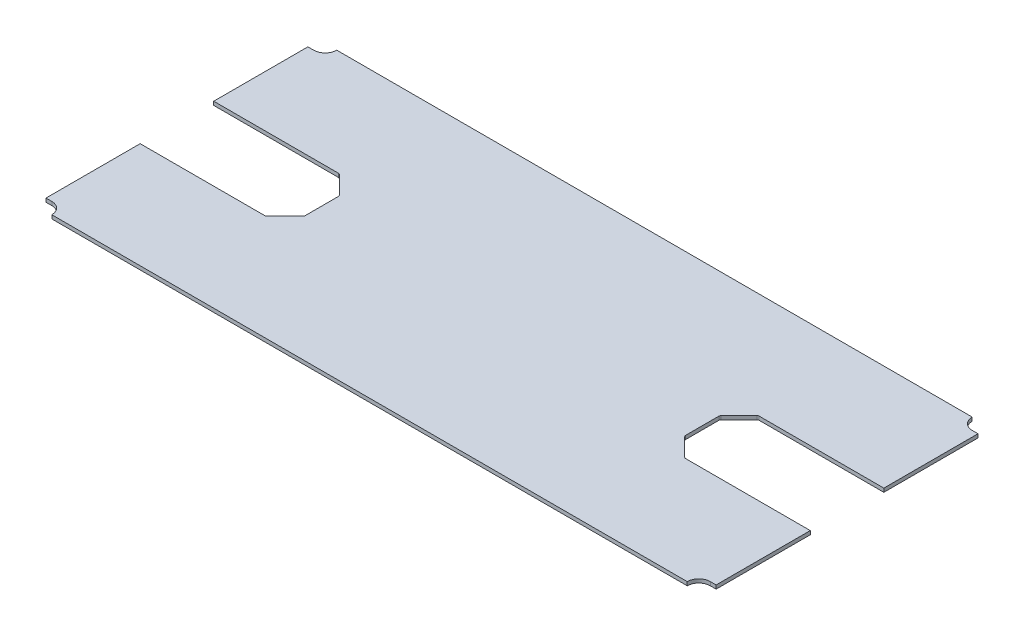
from build123d import *

# Parameters (mm, degrees)
BOSS_EXTRUDE1_DEPTH = 9.525
CHAMFER1_SIZE       = 50
FILLET2_R           = 5


with BuildPart() as part:
    # Sketch1 → Boss-Extrude1 (new body)
    with BuildSketch(Plane(origin=(0, 0, 0), x_dir=(1, 0, 0), z_dir=(0, 1, 0))):
        with BuildLine():
            Line((-870, 340), (-870, 95.5))
            Line((-870, 95.5), (-494, 95.5))
            Line((-494, 95.5), (-494, -95.5))
            Line((-494, -95.5), (-870, -95.5))
            Line((-870, -95.5), (-870, -340))
            Line((-870, -340), (-855, -340))
            ThreePointArc((-855, -340), (-833.786796564, -348.786796564), (-825, -370))
            Line((-825, -370), (825, -370))
            ThreePointArc((825, -370), (833.786796564, -348.786796564), (855, -340))
            Line((855, -340), (870, -340))
            Line((870, -340), (870, -95.5))
            Line((870, -95.5), (494, -95.5))
            Line((494, -95.5), (494, 95.5))
            Line((494, 95.5), (870, 95.5))
            Line((870, 95.5), (870, 340))
            Line((870, 340), (855, 340))
            ThreePointArc((855, 340), (833.786796564, 348.786796564), (825, 370))
            Line((825, 370), (-825, 370))
            ThreePointArc((-825, 370), (-833.786796564, 348.786796564), (-855, 340))
            Line((-855, 340), (-870, 340))
        make_face()
    extrude(amount=BOSS_EXTRUDE1_DEPTH)

    # Chamfer1
    chamfer1_edges = [part.edges().sort_by_distance(p)[0] for p in [
        (494, 4.7625, 95.5),
        (494, 4.7625, -95.5),
        (-494, 4.7625, 95.5),
        (-494, 4.7625, -95.5),
    ]]
    chamfer(chamfer1_edges, length=CHAMFER1_SIZE)

    # Fillet2
    fillet2_edges = [part.edges().sort_by_distance(p)[0] for p in [
        (494, 4.7625, -45.5),
        (494, 4.7625, 45.5),
        (544, 4.7625, 95.5),
        (544, 4.7625, -95.5),
        (-544, 4.7625, 95.5),
        (-494, 4.7625, 45.5),
        (-494, 4.7625, -45.5),
        (-544, 4.7625, -95.5),
    ]]
    fillet(fillet2_edges, radius=FILLET2_R)


solid = part.part
